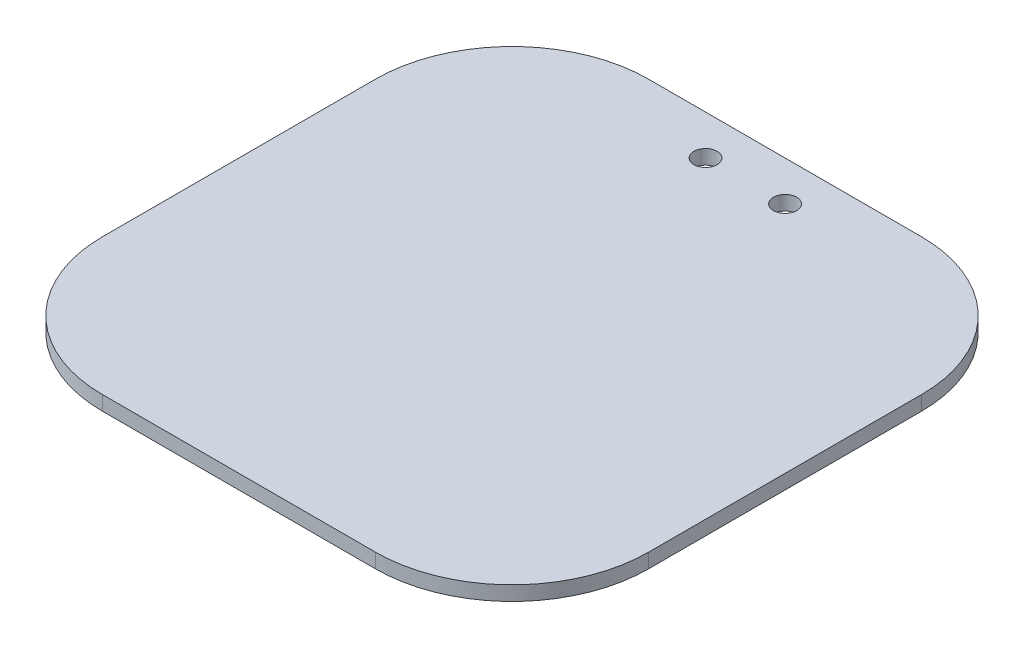
from build123d import *

# Parameters (mm, degrees)
BOSS_EXTRUDE1_DEPTH    = 3.175
F_10_CLEARANCE_HOLE1_D = 5.1054


with BuildPart() as part:
    # Sketch1 → Boss-Extrude1 (new body)
    with BuildSketch(Plane(origin=(0, 0, 0), x_dir=(1, 0, 0), z_dir=(0, 1, 0))):
        with BuildLine():
            Line((-30, 60), (30, 60))
            ThreePointArc((30, 60), (51.213203436, 51.213203436), (60, 30))
            Line((60, 30), (60, -30))
            ThreePointArc((60, -30), (51.213203436, -51.213203436), (30, -60))
            Line((30, -60), (-30, -60))
            ThreePointArc((-30, -60), (-51.213203436, -51.213203436), (-60, -30))
            Line((-60, -30), (-60, 30))
            ThreePointArc((-60, 30), (-51.213203436, 51.213203436), (-30, 60))
        make_face()
    extrude(amount=BOSS_EXTRUDE1_DEPTH)

    # #10 Clearance Hole1 (through all)
    with Locations(Plane(origin=(0, 3.175, 0), x_dir=(1, 0, 0), z_dir=(0, 1, 0))):
        with Locations((8.7376, 51.2624), (-8.7376, 51.2624)):
            Hole(F_10_CLEARANCE_HOLE1_D / 2)


solid = part.part
